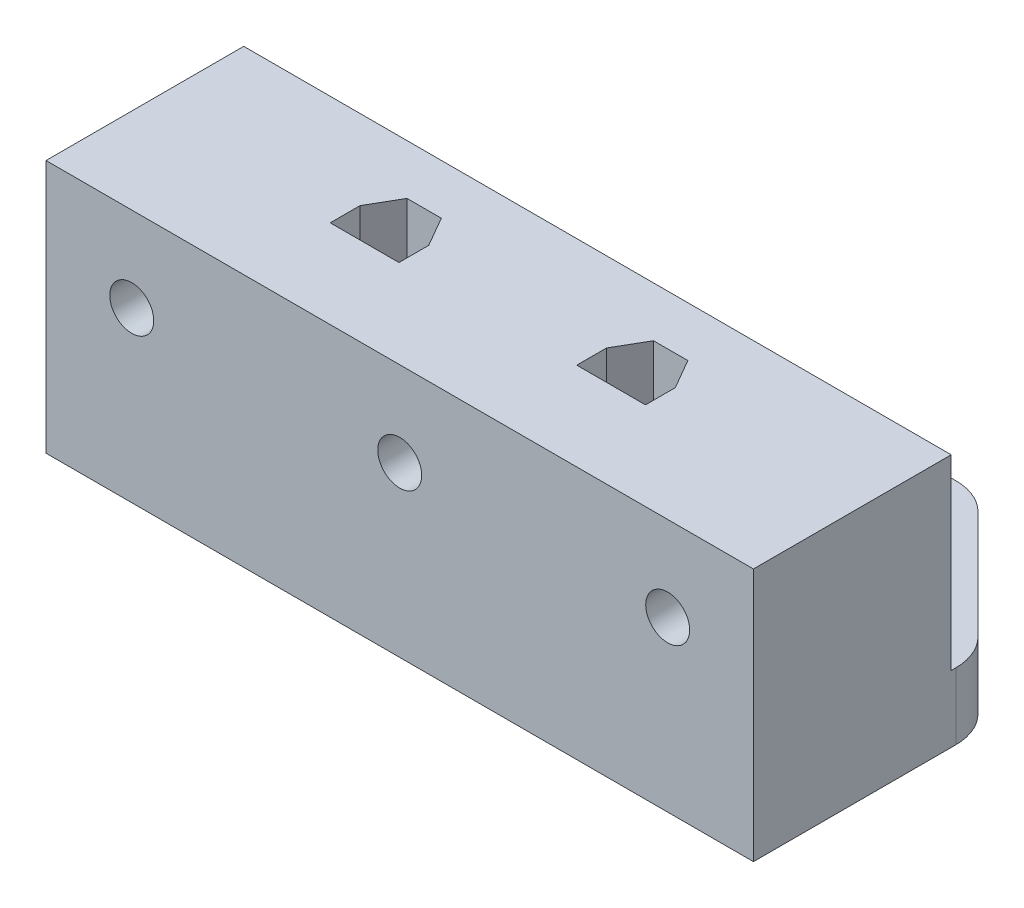
from build123d import *

# Parameters (mm, degrees)
SKETCH1_W           = 62
SKETCH1_H           = 31.1
SKETCH1_R           = 3.3235
BOSS_EXTRUDE1_DEPTH = 12.446
SKETCH1_3_W         = 35
SKETCH1_3_H         = 36.9
SKETCH1_3_W_2       = 62
BOSS_EXTRUDE2_DEPTH = 47.3
SKETCH1_4_R         = 3.3235
BOSS_EXTRUDE3_DEPTH = 21
SKETCH2_R           = 4.1
CUT_EXTRUDE1_DEPTH  = 36.9
CHAMFER1_SIZE       = 40
FILLET3_R           = 10


with BuildPart() as part:
    # Sketch1 → Boss-Extrude1 (new body)
    with BuildSketch(Plane(origin=(0, 0, 0), x_dir=(1, 0, 0), z_dir=(0, 1, 0))):
        with Locations((31, -15.55)):
            Rectangle(SKETCH1_W, SKETCH1_H)
        with Locations(Location((8, -12, 0), (0, 0, 270))):
            Circle(SKETCH1_R, mode=Mode.SUBTRACT)
        with Locations(Location((54, -12, 0), (0, 0, 270))):
            Circle(SKETCH1_R, mode=Mode.SUBTRACT)
    extrude(amount=BOSS_EXTRUDE1_DEPTH)

    # Sketch1<3> → Boss-Extrude2 (add)
    # profile 1 of 3: a face of its own
    with BuildSketch(Plane(origin=(0, 0, 0), x_dir=(1, 0, 0), z_dir=(0, 1, 0))):
        with Locations((-17.5, -49.55)):
            Rectangle(SKETCH1_3_W, SKETCH1_3_H)
    # profile 2 of 3: a face of its own
    with BuildSketch(Plane(origin=(0, 0, 0), x_dir=(1, 0, 0), z_dir=(0, 1, 0))):
        with Locations((31, -49.55)):
            Rectangle(SKETCH1_3_W_2, SKETCH1_3_H)
        Polygon((1.585638509, -46), (4.792819255, -40.445), (11.207180745, -40.445), (14.414361491, -46), (14.414361491, -51.555), (11.207180745, -51.555), (4.792819255, -51.555), (1.585638509, -51.555), align=None, mode=Mode.SUBTRACT)
        Polygon((60.414361491, -46), (60.414361491, -51.555), (47.585638509, -51.555), (47.585638509, -46), (50.792819255, -40.445), (57.207180745, -40.445), align=None, mode=Mode.SUBTRACT)
    # profile 3 of 3: a face of its own
    with BuildSketch(Plane(origin=(0, 0, 0), x_dir=(1, 0, 0), z_dir=(0, 1, 0))):
        with Locations((79.5, -49.55)):
            Rectangle(SKETCH1_3_W, SKETCH1_3_H)
    extrude(amount=BOSS_EXTRUDE2_DEPTH)

    # Sketch1<4> → Boss-Extrude3 (add)
    # profile 1 of 2: a face of its own
    with BuildSketch(Plane(origin=(0, 0, 0), x_dir=(1, 0, 0), z_dir=(0, 1, 0))):
        Polygon((14.414361491, -46), (11.207180745, -40.445), (4.792819255, -40.445), (1.585638509, -46), (1.585638509, -51.555), (14.414361491, -51.555), align=None)
        with Locations(Location((8, -46, 0), (0, 0, 90))):
            Circle(SKETCH1_4_R, mode=Mode.SUBTRACT)
    # profile 2 of 2: a face of its own
    with BuildSketch(Plane(origin=(0, 0, 0), x_dir=(1, 0, 0), z_dir=(0, 1, 0))):
        Polygon((47.585638509, -51.555), (60.414361491, -51.555), (60.414361491, -46), (57.207180745, -40.445), (50.792819255, -40.445), (47.585638509, -46), align=None)
        with Locations(Location((54, -46, 0), (0, 0, 90))):
            Circle(SKETCH1_4_R, mode=Mode.SUBTRACT)
    extrude(amount=BOSS_EXTRUDE3_DEPTH)

    # Sketch2 → Cut-Extrude1 (cut)
    with BuildSketch(Plane(origin=(0, 0, 68), x_dir=(-1, 0, 0), z_dir=(0, 0, -1))):
        with Locations(Location((19, 31.47, 0), (0, 0, 180))):
            Circle(SKETCH2_R)
        with Locations(Location((-31, 31.47, 0), (0, 0, 180))):
            Circle(SKETCH2_R)
        with Locations(Location((-81, 31.47, 0), (0, 0, 180))):
            Circle(SKETCH2_R)
    extrude(amount=CUT_EXTRUDE1_DEPTH, mode=Mode.SUBTRACT)

    # Chamfer1
    # the kernel refuses this chamfer: 40 mm, written as the material it adds along each edge
    with BuildSketch(Plane(origin=(62, 0, 31.1), x_dir=(0.9996219169112968, 0, 0.02749587661058649), z_dir=(0, 1, 0))) as chamfer1_piece_1_section:
        Polygon((CHAMFER1_SIZE * 0.999621916911, CHAMFER1_SIZE * 0.0274958766106), (-CHAMFER1_SIZE * 0.0274958766106, CHAMFER1_SIZE * 0.999621916911), (0, 0), align=None)
    chamfer1_piece_1 = extrude(amount=12.446, mode=Mode.PRIVATE)
    chamfer1_piece_1 = split(chamfer1_piece_1, bisect_by=Plane(origin=(97, 6.223, 19.019433431), z_dir=(-1, 0, 0)), keep=Keep.TOP, mode=Mode.PRIVATE)
    chamfer1_piece_1 = split(chamfer1_piece_1, bisect_by=Plane(origin=(75.290949727, 6.223, 0), z_dir=(0, 0, 1)), keep=Keep.TOP, mode=Mode.PRIVATE)
    add(chamfer1_piece_1)
    with BuildSketch(Plane(origin=(0, 0, 31.1), x_dir=(-0.9996219169112968, 0, 0.027495876610586497), z_dir=(0, 1, 0))) as chamfer1_piece_2_section:
        Polygon((CHAMFER1_SIZE * 0.999621916911, -CHAMFER1_SIZE * 0.0274958766106), (-CHAMFER1_SIZE * 0.0274958766106, -CHAMFER1_SIZE * 0.999621916911), (0, 0), align=None)
    chamfer1_piece_2 = extrude(amount=12.446, mode=Mode.PRIVATE)
    chamfer1_piece_2 = split(chamfer1_piece_2, bisect_by=Plane(origin=(-35, 6.223, 19.019433431), z_dir=(1, 0, 0)), keep=Keep.TOP, mode=Mode.PRIVATE)
    chamfer1_piece_2 = split(chamfer1_piece_2, bisect_by=Plane(origin=(-13.290949727, 6.223, 0), z_dir=(0, 0, 1)), keep=Keep.TOP, mode=Mode.PRIVATE)
    add(chamfer1_piece_2)

    # Fillet3
    fillet3_edges = [part.edges().sort_by_distance(p)[0] for p in [
        (70.9, 6.223, 0),
        (97, 6.223, 26.1),
        (-35, 6.223, 26.1),
        (-8.9, 6.223, 0),
    ]]
    fillet(fillet3_edges, radius=FILLET3_R)


solid = part.part
